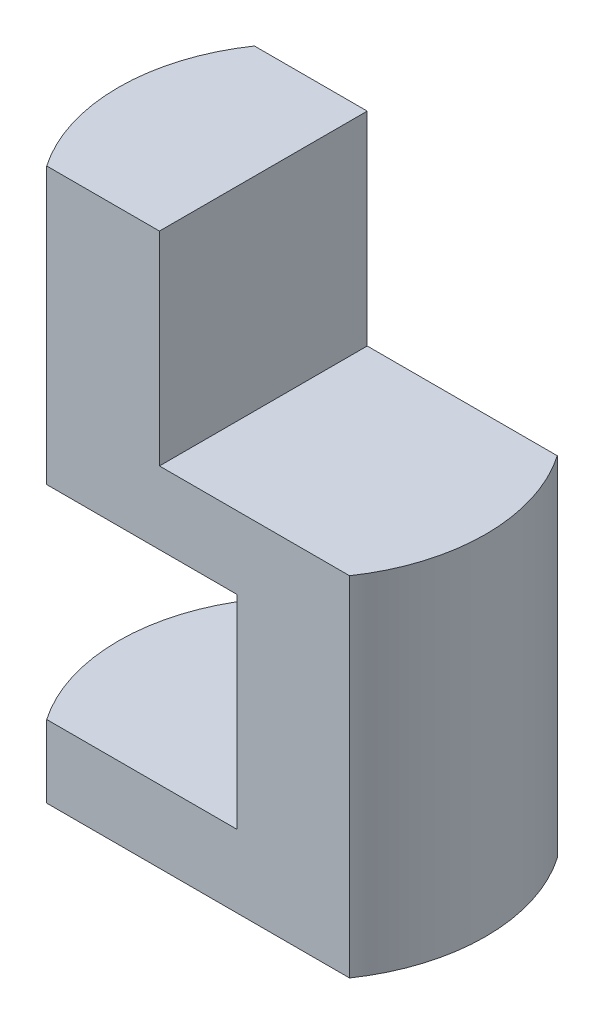
from build123d import *

# Parameters (mm, degrees)
SKETCH1_W           = 76
SKETCH1_H           = 43
BOSS_EXTRUDE1_DEPTH = 15
SKETCH3_W           = 30
SKETCH3_H           = 43
BOSS_EXTRUDE2_DEPTH = 42.1
BOSS_EXTRUDE3_START = 42.1
SKETCH4_W           = 76
SKETCH4_H           = 43
BOSS_EXTRUDE3_DEPTH = 15
SKETCH5_W           = 30
SKETCH5_H           = 43
BOSS_EXTRUDE4_DEPTH = 42.1
CUT_EXTRUDE1_DEPTH  = 114.2


# Read off the part's stored shape, not the designer's step: Cut-Extrude1
with BuildPart() as part:
    # Sketch1 → Boss-Extrude1 (new body)
    with BuildSketch(Plane(origin=(0, 0, 0), x_dir=(1, 0, 0), z_dir=(0, 1, 0))):
        Rectangle(SKETCH1_W, SKETCH1_H)
    extrude(amount=BOSS_EXTRUDE1_DEPTH)

    # Sketch3 → Boss-Extrude2 (add)
    with BuildSketch(Plane(origin=(0, 15, 0), x_dir=(1, 0, 0), z_dir=(0, 1, 0))):
        with Locations((23, 0)):
            Rectangle(SKETCH3_W, SKETCH3_H)
    extrude(amount=BOSS_EXTRUDE2_DEPTH)

    # Sketch4 → Boss-Extrude3 (add)
    with BuildSketch(Plane(origin=(0, 15, 0), x_dir=(1, 0, 0), z_dir=(0, 1, 0)).offset(BOSS_EXTRUDE3_START)):
        Rectangle(SKETCH4_W, SKETCH4_H)
    extrude(amount=BOSS_EXTRUDE3_DEPTH)

    # Sketch5 → Boss-Extrude4 (add)
    with BuildSketch(Plane(origin=(0, 72.1, 0), x_dir=(1, 0, 0), z_dir=(0, 1, 0))):
        with Locations((-23, 0)):
            Rectangle(SKETCH5_W, SKETCH5_H)
    extrude(amount=BOSS_EXTRUDE4_DEPTH)

    # Cut-Extrude1 outline → Cut-Extrude1 (cut)
    with BuildSketch(Plane(origin=(0, 0, 0), x_dir=(1, 0, 0), z_dir=(0, 1, 0))):
        with BuildLine():
            Line((-38, -21.5), (-31.332890068, -21.5))
            ThreePointArc((-31.332890068, -21.5), (-36.294970902, -11.255002765), (-38, 1.36e-07))
            Line((-38, 1.36e-07), (-38, -21.5))
        make_face()
        with BuildLine():
            Line((-38, 21.5), (-38, 1.36e-07))
            ThreePointArc((-38, 1.36e-07), (-36.294970861, 11.255002895), (-31.332890068, 21.5))
            Line((-31.332890068, 21.5), (-38, 21.5))
        make_face()
        with BuildLine():
            ThreePointArc((38, -1.36e-07), (36.294970861, -11.255002895), (31.332890068, -21.5))
            Line((31.332890068, -21.5), (38, -21.5))
            Line((38, -21.5), (38, -1.36e-07))
        make_face()
        with BuildLine():
            ThreePointArc((31.332890068, 21.5), (36.294970902, 11.255002765), (38, -1.36e-07))
            Line((38, -1.36e-07), (38, 21.5))
            Line((38, 21.5), (31.332890068, 21.5))
        make_face()
    extrude(amount=CUT_EXTRUDE1_DEPTH, mode=Mode.SUBTRACT)


solid = part.part
